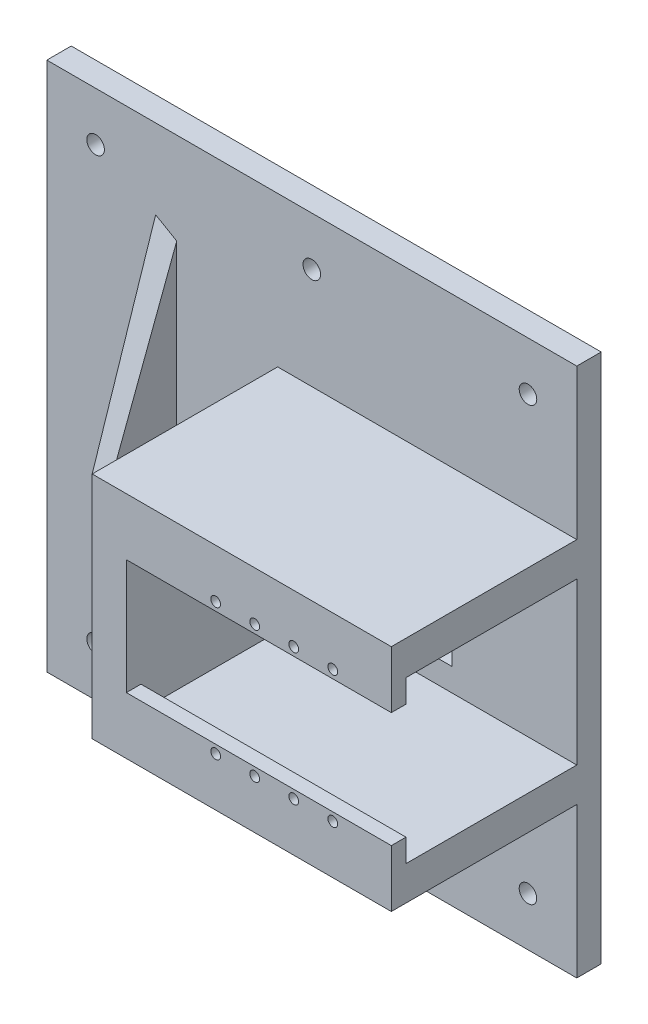
from build123d import *

# Parameters (mm, degrees)
ESQUISSE1_R             = 1.8
BOSS_EXTRU_1_DEPTH      = 5
BOSS_EXTRU_2_DEPTH      = 35
ESQUISSE3_R             = 1
BOSS_EXTRU_3_DEPTH      = 3
ESQUISSE4_W             = 8.59995714
ESQUISSE4_H             = 23.592650329
ENL_V_MAT_EXTRU_1_DEPTH = 5


with BuildPart() as part:
    # Esquisse1 → Boss.-Extru.1 (new body)
    with BuildSketch(Plane(origin=(0, 0, 0), x_dir=(-1, 0, 0), z_dir=(0, 0, 1))):
        Polygon((96.824454852, 121.477817805), (96.824454852, 131.477817805), (-1.765545148, 131.477817805), (-11.765545148, 131.477817805), (-11.765545148, 22.887817805), (-1.765545148, 22.887817805), (42.529454852, 22.887817805), (86.824454852, 22.887817805), (96.824454852, 22.887817805), align=None)
        with BuildLine():
            ThreePointArc((0.034454852, 32.887817805), (-0.492752942, 31.615025599), (-1.765545148, 31.087817805))
            ThreePointArc((-1.765545148, 31.087817805), (-3.038337355, 34.160610011), (0.034454852, 32.887817805))
        make_face(mode=Mode.SUBTRACT)
        with BuildLine():
            ThreePointArc((44.329454852, 32.887817805), (43.802247058, 31.615025599), (42.529454852, 31.087817805))
            ThreePointArc((42.529454852, 31.087817805), (40.729454852, 32.887817805), (42.529454852, 34.687817805))
            ThreePointArc((42.529454852, 34.687817805), (43.802247058, 34.160610011), (44.329454852, 32.887817805))
        make_face(mode=Mode.SUBTRACT)
        with BuildLine():
            ThreePointArc((88.624454852, 32.887817805), (88.097247058, 31.615025599), (86.824454852, 31.087817805))
            ThreePointArc((86.824454852, 31.087817805), (85.551662645, 34.160610011), (88.624454852, 32.887817805))
        make_face(mode=Mode.SUBTRACT)
        with BuildLine():
            ThreePointArc((0.034454852, 121.477817805), (-3.038337355, 120.205025599), (-1.765545148, 123.277817805))
            ThreePointArc((-1.765545148, 123.277817805), (-0.492752942, 122.750610011), (0.034454852, 121.477817805))
        make_face(mode=Mode.SUBTRACT)
        with BuildLine():
            ThreePointArc((44.329454852, 121.477817805), (43.802247058, 120.205025599), (42.529454852, 119.677817805))
            ThreePointArc((42.529454852, 119.677817805), (41.256662645, 122.750610011), (44.329454852, 121.477817805))
        make_face(mode=Mode.SUBTRACT)
        with Locations((86.824454852, 121.477817805)):
            Circle(ESQUISSE1_R, mode=Mode.SUBTRACT)
    extrude(amount=BOSS_EXTRU_1_DEPTH)

    # Esquisse2 → Boss.-Extru.2 (add)
    with BuildSketch(Plane.XY.offset(5)):
        Polygon((11.765545148, -53.682817805), (-49.529454852, -53.682817805), (-49.529454852, -100.682817805), (11.765545148, -100.682817805), (11.765545148, -93.682817805), (-42.529454852, -93.682817805), (-42.529454852, -60.682817805), (11.765545148, -60.682817805), align=None)
    extrude(amount=BOSS_EXTRU_2_DEPTH)

    # Esquisse3 → Boss.-Extru.3 (add)
    with BuildSketch(Plane.XY.offset(40)):
        Polygon((-42.529454852, -65.390167476), (11.765545148, -65.390167476), (11.765545148, -53.682817805), (-49.529454852, -53.682817805), (-49.529454852, -100.682817805), (11.765545148, -100.682817805), (11.765545148, -88.982817805), (-42.529454852, -88.982817805), align=None)
        with Locations((-24.229454852, -63.682817805)):
            Circle(ESQUISSE3_R, mode=Mode.SUBTRACT)
        with BuildLine():
            ThreePointArc((-15.229454852, -63.682817805), (-16.229454852, -64.682817805), (-17.229454852, -63.682817805))
            ThreePointArc((-17.229454852, -63.682817805), (-16.229454852, -62.682817805), (-15.229454852, -63.682817805))
        make_face(mode=Mode.SUBTRACT)
        with BuildLine():
            ThreePointArc((-7.229454852, -63.682817805), (-8.229454852, -64.682817805), (-9.229454852, -63.682817805))
            ThreePointArc((-9.229454852, -63.682817805), (-8.229454852, -62.682817805), (-7.229454852, -63.682817805))
        make_face(mode=Mode.SUBTRACT)
        with Locations((-0.229454852, -63.682817805)):
            Circle(ESQUISSE3_R, mode=Mode.SUBTRACT)
        with Locations((-24.229454852, -90.682817805)):
            Circle(ESQUISSE3_R, mode=Mode.SUBTRACT)
        with BuildLine():
            ThreePointArc((-15.229454852, -90.682817805), (-16.229454852, -91.682817805), (-17.229454852, -90.682817805))
            ThreePointArc((-17.229454852, -90.682817805), (-16.229454852, -89.682817805), (-15.229454852, -90.682817805))
        make_face(mode=Mode.SUBTRACT)
        with BuildLine():
            ThreePointArc((-7.229454852, -90.682817805), (-8.229454852, -91.682817805), (-9.229454852, -90.682817805))
            ThreePointArc((-9.229454852, -90.682817805), (-8.229454852, -89.682817805), (-7.229454852, -90.682817805))
        make_face(mode=Mode.SUBTRACT)
        with Locations((-0.229454852, -90.682817805)):
            Circle(ESQUISSE3_R, mode=Mode.SUBTRACT)
    extrude(amount=BOSS_EXTRU_3_DEPTH)

    # Esquisse4 → Enlèv. mat.-Extru.1 (cut)
    with BuildSketch(Plane.XY.offset(5)):
        with Locations((-18.074099951, -77.186492641)):
            Rectangle(ESQUISSE4_W, ESQUISSE4_H)
    extrude(amount=-ENL_V_MAT_EXTRU_1_DEPTH, mode=Mode.SUBTRACT)

    # Esquisse5 → Lissage3 section 0
    with BuildSketch(Plane.ZY.offset(49.529454852)):
        with BuildLine():
            Line((43, -100.682817805), (38, -100.682817805))
            Line((38, -100.682817805), (38, -53.682817805))
            Line((38, -53.682817805), (43, -53.682817805))
            Line((43, -53.682817805), (43, -100.682817805))
        make_face()
    # Esquisse6 → Lissage3 section 1
    with BuildSketch(Plane.XY.offset(5)):
        with BuildLine():
            Line((-74.529454852, -115.182817805), (-74.529454852, -39.182817805))
            Line((-74.529454852, -39.182817805), (-70.204298905, -41.691408254))
            Line((-70.204298905, -41.691408254), (-70.204298905, -112.674227356))
            Line((-70.204298905, -112.674227356), (-74.529454852, -115.182817805))
        make_face()
    loft()


solid = part.part
